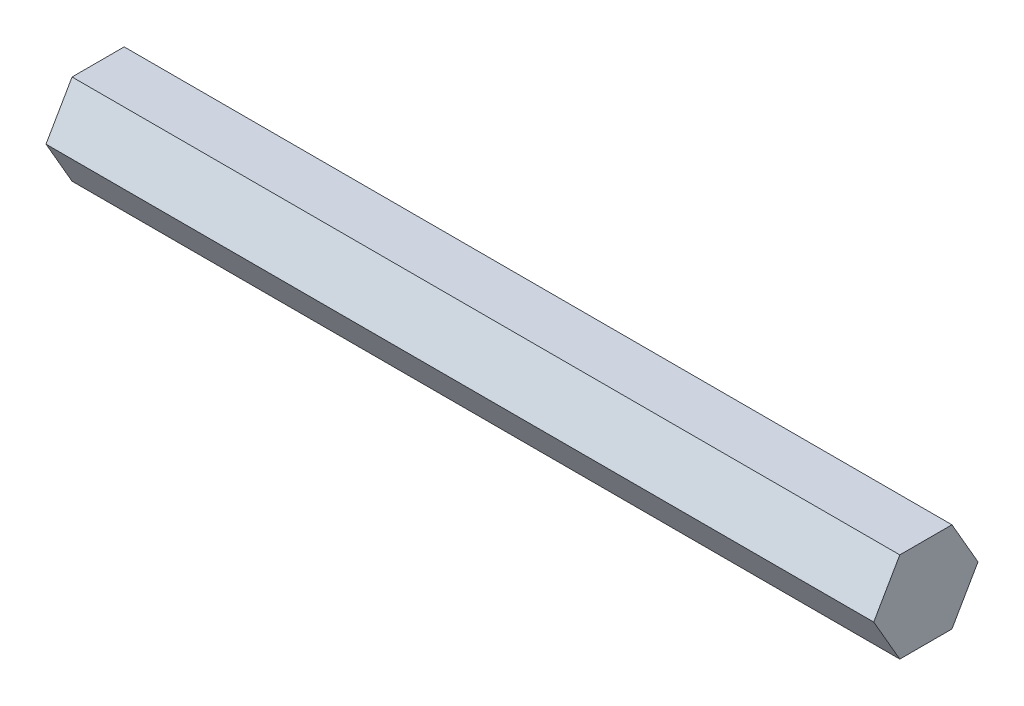
from build123d import *

# Parameters (mm, degrees)
BOSS_EXTRUDE1_DEPTH = 110


with BuildPart() as part:
    # Sketch1 → Boss-Extrude1 (new body)
    with BuildSketch(Plane(origin=(0, 0, 0), x_dir=(0, 0, -1), z_dir=(1, 0, 0))):
        Polygon((6.92820323, 0), (3.464101615, 6), (-3.464101615, 6), (-6.92820323, 0), (-3.464101615, -6), (3.464101615, -6), align=None)
    extrude(amount=BOSS_EXTRUDE1_DEPTH)


solid = part.part
